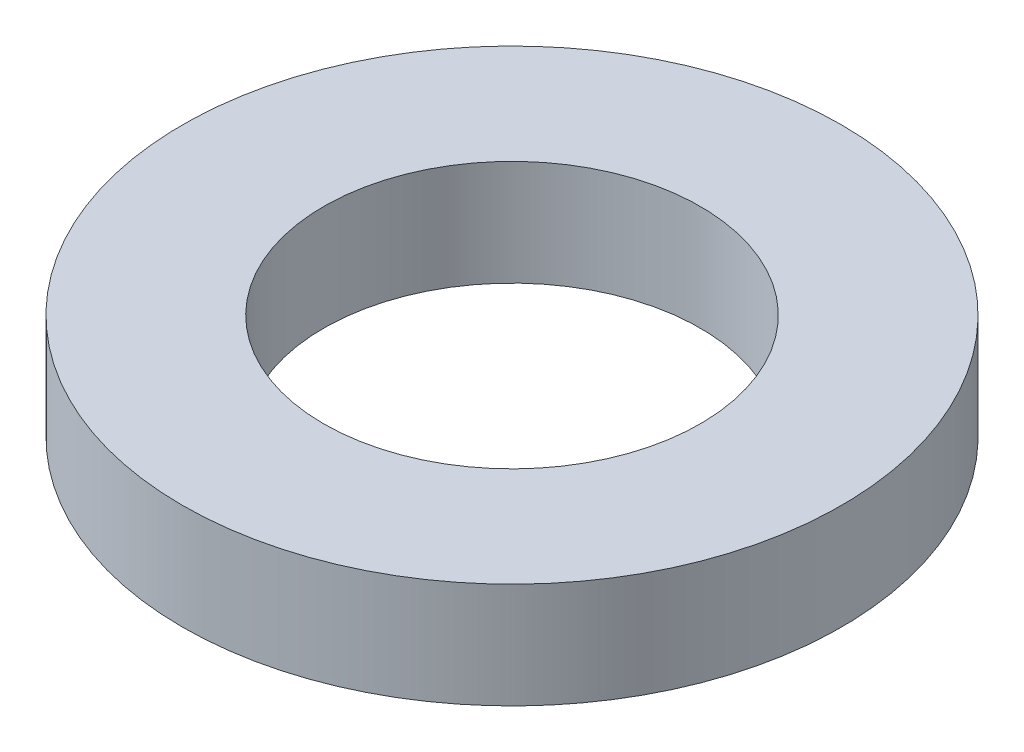
from build123d import *

# Parameters (mm, degrees)
SKETCH1_R           = 87.5
BOSS_EXTRUDE1_DEPTH = 28
SKETCH2_R           = 50
CUT_EXTRUDE1_DEPTH  = 127.871982723


with BuildPart() as part:
    # Sketch1 → Boss-Extrude1 (new body)
    with BuildSketch(Plane(origin=(0, 0, 0), x_dir=(1, 0, 0), z_dir=(0, 1, 0))):
        Circle(SKETCH1_R)
    extrude(amount=BOSS_EXTRUDE1_DEPTH)

    # Sketch2 → Cut-Extrude1 (cut, through all)
    with BuildSketch(Plane(origin=(0, 0, 0), x_dir=(1, 0, 0), z_dir=(0, 1, 0))):
        Circle(SKETCH2_R)
    extrude(amount=CUT_EXTRUDE1_DEPTH, mode=Mode.SUBTRACT)


solid = part.part
